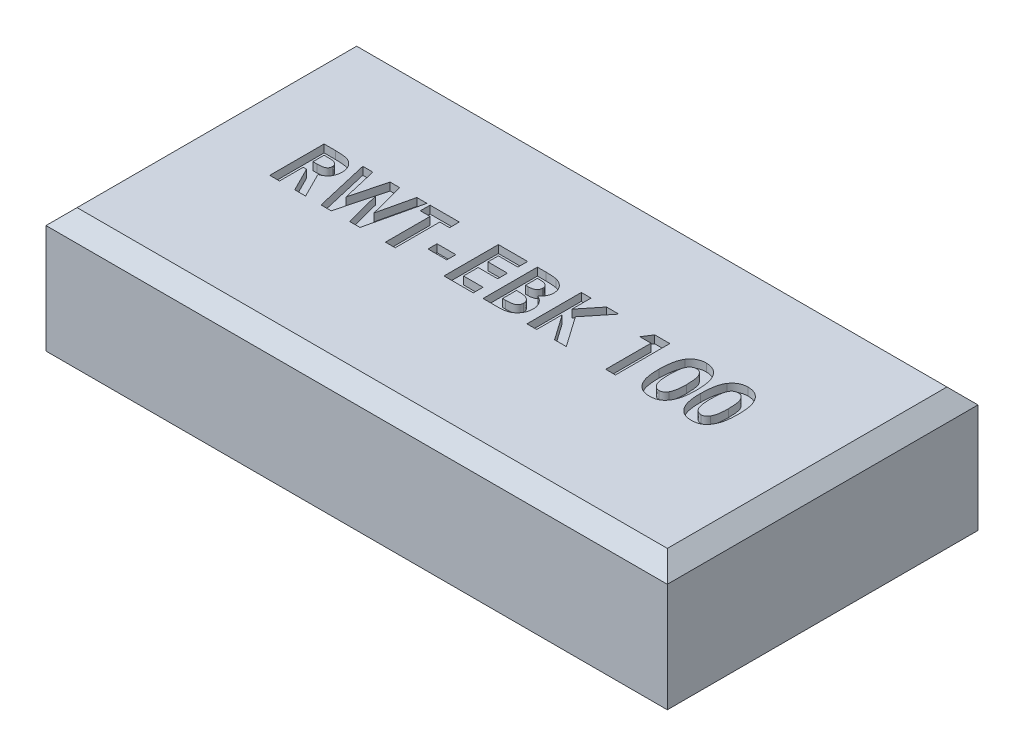
from build123d import *

# Parameters (mm, degrees)
SKETCH1_W           = 40
SKETCH1_H           = 20
BOSS_EXTRUDE1_DEPTH = 8
CHAMFER1_SIZE       = 1
SKETCH3_W           = 1.211538461
SKETCH3_H           = 0.583333333
CUT_EXTRUDE2_DEPTH  = 0.5


with BuildPart() as part:
    # Sketch1 → Boss-Extrude1 (new body)
    with BuildSketch(Plane(origin=(0, 0, 0), x_dir=(1, 0, 0), z_dir=(0, 1, 0))):
        with Locations((0, 2.318501171)):
            Rectangle(SKETCH1_W, SKETCH1_H)
    extrude(amount=BOSS_EXTRUDE1_DEPTH)

    # Chamfer1
    chamfer1_edges = [part.edges().sort_by_distance(p)[0] for p in [
        (0, 8, 7.681498829),
        (-20, 8, -2.318501171),
        (0, 8, -12.318501171),
        (20, 8, -2.318501171),
    ]]
    chamfer(chamfer1_edges, length=CHAMFER1_SIZE)

    # Sketch3 → Cut-Extrude2 (cut)
    # profile 1 of 10: a face of its own
    with BuildSketch(Plane(origin=(0, 8, 0), x_dir=(1, 0, 0), z_dir=(0, 1, 0))):
        with BuildLine():
            Line((-14.596153846, 4.818501171), (-13.864182692, 4.818501171))
            add(Edge.make_bspline(
                [(-13.864182692, 4.818501171), (-13.815799622, 4.818329439), (-13.722745349, 4.81799915), (-13.588566169, 4.81278806), (-13.46530414, 4.805536401), (-13.352776761, 4.794470177), (-13.251032173, 4.779797701), (-13.159968404, 4.76250128), (-13.079588115, 4.742788301), (-13.009213411, 4.718224373), (-12.945703721, 4.690516634), (-12.886503859, 4.658679935), (-12.830307791, 4.623068786), (-12.777491125, 4.582746162), (-12.727594872, 4.538437457), (-12.6805249, 4.49009807), (-12.636946351, 4.437318103), (-12.597129066, 4.380431058), (-12.560838815, 4.320587191), (-12.528765845, 4.257704336), (-12.502684052, 4.191738763), (-12.479637993, 4.123643816), (-12.463038663, 4.052446065), (-12.451494071, 3.978838632), (-12.443041573, 3.902562411), (-12.442555595, 3.850743733), (-12.442307692, 3.824310466)],
                knots=[0, 0, 0, 0, 1.749336639, 3.364467119, 4.854658419, 6.213483162, 7.451590619, 8.570285859, 9.5643256, 10.440900261, 11.26203566, 12.067320669, 12.869050712, 13.665104639, 14.467235401, 15.27997916, 16.102287765, 16.939272006, 17.78853747, 18.631303466, 19.488103222, 20.351255419, 21.228522269, 22.127379805, 23.044756219, 24, 24, 24, 24], degree=3))
            add(Edge.make_bspline(
                [(-12.442307692, 3.824310466), (-12.442951654, 3.796720207), (-12.444214347, 3.742620739), (-12.451015895, 3.663153032), (-12.46344699, 3.587123888), (-12.48227569, 3.514755912), (-12.503916836, 3.4451484), (-12.532694008, 3.379585653), (-12.565171892, 3.317114157), (-12.603744925, 3.258617595), (-12.646076944, 3.20279664), (-12.695308193, 3.151790002), (-12.748249241, 3.102856265), (-12.807876098, 3.059060474), (-12.871560358, 3.017441316), (-12.940567358, 2.979723274), (-13.014446736, 2.944958206), (-13.066387598, 2.925570802), (-13.092948718, 2.91565662)],
                knots=[0, 0, 0, 0, 1.099860209, 2.156625411, 3.176576793, 4.16617041, 5.135385252, 6.078461593, 7.016046972, 7.938469504, 8.868247731, 9.803980173, 10.76021508, 11.73834243, 12.748633912, 13.790971185, 14.870363756, 16, 16, 16, 16], degree=3))
            Line((-13.092948718, 2.91565662), (-12.28525641, 1.318501171))
            Line((-12.28525641, 1.318501171), (-12.983573718, 1.318501171))
            Line((-12.983573718, 1.318501171), (-13.754807692, 2.844142197))
            Line((-13.754807692, 2.844142197), (-13.967948718, 2.844142197))
            Line((-13.967948718, 2.844142197), (-13.967948718, 1.318501171))
            Line((-13.967948718, 1.318501171), (-14.596153846, 1.318501171))
            Line((-14.596153846, 1.318501171), (-14.596153846, 4.818501171))
        make_face()
        with BuildLine():
            Line((-13.967948718, 3.472347325), (-13.723257212, 3.472347325))
            add(Edge.make_bspline(
                [(-13.723257212, 3.472347325), (-13.693341641, 3.472684254), (-13.636059751, 3.473329401), (-13.55368087, 3.476321861), (-13.4788612, 3.483532211), (-13.41127944, 3.492642218), (-13.350595524, 3.503161037), (-13.297350732, 3.518235143), (-13.250724642, 3.534387429), (-13.211269776, 3.554460531), (-13.177560445, 3.577288002), (-13.148454596, 3.603220576), (-13.124379885, 3.633234229), (-13.104565169, 3.666513318), (-13.089151475, 3.70335219), (-13.07790066, 3.743346436), (-13.071613117, 3.786951643), (-13.070889714, 3.817045173), (-13.070512821, 3.832723927)],
                knots=[0, 0, 0, 0, 1.688639943, 3.233382647, 4.650958383, 5.928841754, 7.082724185, 8.122798841, 9.049171256, 9.863274652, 10.613301712, 11.341792392, 12.054588806, 12.776240173, 13.521029143, 14.301969904, 15.115324896, 16, 16, 16, 16], degree=3))
            add(Edge.make_bspline(
                [(-13.070512821, 3.832723927), (-13.071225372, 3.851273039), (-13.072625049, 3.88770933), (-13.086514186, 3.940164814), (-13.108622693, 3.988715953), (-13.1389274, 4.033143381), (-13.177092239, 4.072091531), (-13.220889403, 4.106424636), (-13.27126414, 4.133572687), (-13.317907356, 4.151479252), (-13.36034178, 4.162192934), (-13.398637509, 4.170176676), (-13.442984193, 4.175834983), (-13.493415313, 4.181836624), (-13.549802317, 4.185728385), (-13.612452548, 4.188568594), (-13.681186076, 4.189730664), (-13.729099873, 4.190102157), (-13.754106571, 4.190296043)],
                knots=[0, 0, 0, 0, 1.020303359, 2.004196876, 2.966617323, 3.9489082, 4.950758222, 5.960522915, 7.003732012, 8.091992268, 8.70421221, 9.413913587, 10.24622431, 11.166358409, 12.212345909, 13.359657661, 14.621978493, 16, 16, 16, 16], degree=3))
            Line((-13.754106571, 4.190296043), (-13.967948718, 4.190296043))
            Line((-13.967948718, 4.190296043), (-13.967948718, 3.472347325))
        make_face(mode=Mode.SUBTRACT)
    # profile 2 of 10: a face of its own
    with BuildSketch(Plane(origin=(0, 8, 0), x_dir=(1, 0, 0), z_dir=(0, 1, 0))):
        Polygon((-12.105769231, 4.818501171), (-11.457231571, 4.818501171), (-10.939102564, 2.584026011), (-10.345252404, 4.818501171), (-9.734575321, 4.818501171), (-9.144230769, 2.584026011), (-8.627504006, 4.818501171), (-7.977564103, 4.818501171), (-8.787359776, 1.318501171), (-9.443609776, 1.318501171), (-10.041666667, 3.581021203), (-10.643229167, 1.318501171), (-11.294571314, 1.318501171), align=None)
    # profile 3 of 10: a face of its own
    with BuildSketch(Plane(origin=(0, 8, 0), x_dir=(1, 0, 0), z_dir=(0, 1, 0))):
        Polygon((-7.775641026, 4.818501171), (-5.891025641, 4.818501171), (-5.891025641, 4.190296043), (-6.519230769, 4.190296043), (-6.519230769, 1.318501171), (-7.147435897, 1.318501171), (-7.147435897, 4.190296043), (-7.775641026, 4.190296043), align=None)
    # profile 4 of 10: a face of its own
    with BuildSketch(Plane(origin=(0, 8, 0), x_dir=(1, 0, 0), z_dir=(0, 1, 0))):
        with Locations((-4.791666667, 2.597347325)):
            Rectangle(SKETCH3_W, SKETCH3_H)
    # profile 5 of 10: a face of its own
    with BuildSketch(Plane(origin=(0, 8, 0), x_dir=(1, 0, 0), z_dir=(0, 1, 0))):
        Polygon((-3.378205128, 4.818501171), (-1.493589744, 4.818501171), (-1.493589744, 4.190296043), (-2.75, 4.190296043), (-2.75, 3.51721912), (-1.493589744, 3.51721912), (-1.493589744, 2.889013991), (-2.75, 2.889013991), (-2.75, 1.946706299), (-1.493589744, 1.946706299), (-1.493589744, 1.318501171), (-3.378205128, 1.318501171), align=None)
    # profile 6 of 10: a face of its own
    with BuildSketch(Plane(origin=(0, 8, 0), x_dir=(1, 0, 0), z_dir=(0, 1, 0))):
        with BuildLine():
            Line((-0.865384615, 1.318501171), (-0.865384615, 4.818501171))
            Line((-0.865384615, 4.818501171), (-0.304487179, 4.818501171))
            add(Edge.make_bspline(
                [(-0.304487179, 4.818501171), (-0.265220852, 4.818505652), (-0.189241252, 4.818514323), (-0.079622519, 4.814664873), (0.022039599, 4.809685178), (0.115421572, 4.804114058), (0.200682344, 4.794513904), (0.277692262, 4.784396391), (0.346605192, 4.772195293), (0.389210312, 4.76125053), (0.409254808, 4.756101331)],
                knots=[0, 0, 0, 0, 1.311965854, 2.538629056, 3.664479157, 4.713267157, 5.663616078, 6.530575999, 7.308677837, 8, 8, 8, 8], degree=3))
            add(Edge.make_bspline(
                [(0.409254808, 4.756101331), (0.435575266, 4.748838294), (0.487224455, 4.734585883), (0.561202576, 4.705802524), (0.631381143, 4.673807779), (0.697674471, 4.637307759), (0.759675491, 4.595861807), (0.817148578, 4.549140995), (0.871333285, 4.499020694), (0.920305637, 4.444104065), (0.964568575, 4.386074475), (1.003025131, 4.324947127), (1.03643895, 4.2616567), (1.063178757, 4.195406725), (1.083326699, 4.126502301), (1.09806282, 4.055237661), (1.107613822, 3.981387306), (1.108516267, 3.931144495), (1.108974359, 3.905640594)],
                knots=[0, 0, 0, 0, 1.099996261, 2.158545794, 3.195537121, 4.207578794, 5.205712374, 6.197378256, 7.190519799, 8.17788031, 9.159561366, 10.129234751, 11.085776129, 12.040971148, 13.00380137, 13.975669004, 14.972423361, 16, 16, 16, 16], degree=3))
            add(Edge.make_bspline(
                [(1.108974359, 3.905640594), (1.107776583, 3.872874775), (1.105418909, 3.808379286), (1.090357925, 3.713647082), (1.062116233, 3.624111532), (1.025162666, 3.538122532), (0.974917368, 3.456000819), (0.911115557, 3.377785442), (0.834790614, 3.30106803), (0.776245169, 3.255081117), (0.745793269, 3.231161427)],
                knots=[0, 0, 0, 0, 0.986156485, 1.941127874, 2.875419072, 3.804401753, 4.751181392, 5.761612777, 6.835722519, 8, 8, 8, 8], degree=3))
            add(Edge.make_bspline(
                [(0.745793269, 3.231161427), (0.770470028, 3.218564156), (0.818854324, 3.193864392), (0.887545811, 3.153265354), (0.951146629, 3.110083128), (1.009941945, 3.065186558), (1.062698461, 3.016672412), (1.111594582, 2.967336144), (1.154218027, 2.914350989), (1.192333195, 2.85960544), (1.225462281, 2.802306775), (1.254314061, 2.742551757), (1.278684124, 2.680136252), (1.299321324, 2.615377904), (1.314712554, 2.548053973), (1.324747963, 2.478140383), (1.332431699, 2.405875574), (1.333029422, 2.35665059), (1.333333333, 2.331622165)],
                knots=[0, 0, 0, 0, 1.164658916, 2.283573913, 3.35186032, 4.395461096, 5.390182219, 6.362969632, 7.312859996, 8.245001507, 9.165155236, 10.092416118, 11.032087915, 11.979892451, 12.947605196, 13.931445124, 14.948243989, 16, 16, 16, 16], degree=3))
            add(Edge.make_bspline(
                [(1.333333333, 2.331622165), (1.331361149, 2.283819302), (1.327469051, 2.189480545), (1.29901193, 2.050969584), (1.249676325, 1.91964863), (1.18342878, 1.796039608), (1.101799059, 1.683720797), (1.007948289, 1.585330494), (0.902821331, 1.502045287), (0.805829006, 1.445834233), (0.721938284, 1.40811136), (0.652453165, 1.384788701), (0.577827621, 1.363182624), (0.49669469, 1.348010391), (0.410525202, 1.334123096), (0.318478999, 1.325548791), (0.220728113, 1.319738197), (0.153588579, 1.318921849), (0.118990385, 1.318501171)],
                knots=[0, 0, 0, 0, 1.284142165, 2.534249414, 3.780121997, 5.041676246, 6.291546858, 7.49970053, 8.684500223, 9.883330709, 10.50184324, 11.153274765, 11.851151195, 12.587658647, 13.369265475, 14.195992086, 15.070362669, 16, 16, 16, 16], degree=3))
            Line((0.118990385, 1.318501171), (-0.865384615, 1.318501171))
        make_face()
        with BuildLine():
            Line((-0.237179487, 4.190296043), (-0.237179487, 3.42747553))
            Line((-0.237179487, 3.42747553), (-0.0703125, 3.42747553))
            add(Edge.make_bspline(
                [(-0.0703125, 3.42747553), (-0.047633777, 3.427673297), (-0.003853875, 3.428055074), (0.059381549, 3.432972233), (0.118180282, 3.441361212), (0.172319311, 3.453065948), (0.222302963, 3.467929257), (0.267811927, 3.485813017), (0.308646108, 3.507633149), (0.356085982, 3.540135198), (0.406233349, 3.587963419), (0.450377513, 3.657061193), (0.476378131, 3.736523371), (0.479273899, 3.792566252), (0.480769231, 3.821505979)],
                knots=[0, 0, 0, 0, 1.065314748, 2.056525647, 2.977365736, 3.853934255, 4.656397591, 5.425096493, 6.14721249, 6.826394842, 8.123232004, 9.372140726, 10.643011755, 12, 12, 12, 12], degree=3))
            add(Edge.make_bspline(
                [(0.480769231, 3.821505979), (0.479572691, 3.848612841), (0.47725923, 3.901022871), (0.451079951, 3.97461122), (0.410418355, 4.039825558), (0.362411626, 4.084459439), (0.317203962, 4.114943064), (0.278494386, 4.135015233), (0.236007719, 4.152983634), (0.188921466, 4.166722711), (0.137504514, 4.17703203), (0.082006625, 4.184602991), (0.022332045, 4.189756109), (-0.018885315, 4.190112204), (-0.040164263, 4.190296043)],
                knots=[0, 0, 0, 0, 1.347982417, 2.606269829, 3.849316587, 5.153353503, 5.842674298, 6.568177932, 7.326619318, 8.142485038, 9.012069166, 9.942760135, 10.937925643, 12, 12, 12, 12], degree=3))
            Line((-0.040164263, 4.190296043), (-0.237179487, 4.190296043))
        make_face(mode=Mode.SUBTRACT)
        with BuildLine():
            Line((-0.237179487, 2.844142197), (-0.237179487, 1.946706299))
            Line((-0.237179487, 1.946706299), (-0.056290064, 1.946706299))
            add(Edge.make_bspline(
                [(-0.056290064, 1.946706299), (-0.020527995, 1.946910607), (0.048229046, 1.947303413), (0.146723385, 1.952049449), (0.236279363, 1.960603342), (0.316659689, 1.971282188), (0.387987483, 1.985750355), (0.450021639, 2.004144774), (0.503612874, 2.02438184), (0.548439854, 2.049377018), (0.585060929, 2.078465208), (0.618107609, 2.108194036), (0.645051813, 2.142489048), (0.666370569, 2.179878054), (0.684821916, 2.219432285), (0.695950465, 2.262696318), (0.704423352, 2.308387911), (0.704889637, 2.339991798), (0.705128205, 2.356161427)],
                knots=[0, 0, 0, 0, 1.753078804, 3.370512758, 4.83203934, 6.162291463, 7.344201807, 8.395507345, 9.331626367, 10.147333109, 10.898971645, 11.62040215, 12.321813352, 13.025280112, 13.727906689, 14.453419512, 15.208716525, 16, 16, 16, 16], degree=3))
            add(Edge.make_bspline(
                [(0.705128205, 2.356161427), (0.704602095, 2.374651653), (0.703577374, 2.410665639), (0.695208464, 2.463303922), (0.67999942, 2.512445252), (0.660842888, 2.559346239), (0.634185556, 2.602327663), (0.602504228, 2.642876951), (0.564225095, 2.679620976), (0.521177978, 2.714782156), (0.470967777, 2.745567673), (0.413570936, 2.772279563), (0.348675643, 2.79458835), (0.27608088, 2.81235062), (0.196104895, 2.827425213), (0.108163951, 2.83642641), (0.012990452, 2.843120995), (-0.053004401, 2.843794061), (-0.087139423, 2.844142197)],
                knots=[0, 0, 0, 0, 0.845221588, 1.646264278, 2.427170338, 3.19324141, 3.95557735, 4.731569926, 5.540061037, 6.376114724, 7.268642756, 8.224665384, 9.265483498, 10.400594375, 11.639216012, 12.983232105, 14.439614077, 16, 16, 16, 16], degree=3))
            Line((-0.087139423, 2.844142197), (-0.237179487, 2.844142197))
        make_face(mode=Mode.SUBTRACT)
    # profile 7 of 10: a face of its own
    with BuildSketch(Plane(origin=(0, 8, 0), x_dir=(1, 0, 0), z_dir=(0, 1, 0))):
        Polygon((1.961538462, 4.818501171), (2.58974359, 4.818501171), (2.58974359, 3.586630177), (3.582532051, 4.818501171), (4.375500801, 4.818501171), (3.128205128, 3.270424248), (4.496794872, 1.318501171), (3.740284455, 1.318501171), (2.58974359, 2.959827293), (2.58974359, 1.318501171), (1.961538462, 1.318501171), align=None)
    # profile 8 of 10: a face of its own
    with BuildSketch(Plane(origin=(0, 8, 0), x_dir=(1, 0, 0), z_dir=(0, 1, 0))):
        Polygon((6.689202724, 4.818501171), (7.66025641, 4.818501171), (7.66025641, 1.318501171), (7.032051282, 1.318501171), (7.032051282, 4.235167838), (6.314102564, 4.235167838), align=None)
    # profile 9 of 10: a face of its own
    with BuildSketch(Plane(origin=(0, 8, 0), x_dir=(1, 0, 0), z_dir=(0, 1, 0))):
        with BuildLine():
            add(Edge.make_bspline(
                [(9.915765224, 4.908244761), (9.94617296, 4.907793349), (10.005962692, 4.906905754), (10.094021714, 4.897292372), (10.178846898, 4.882769234), (10.260770092, 4.86251452), (10.339201605, 4.835708128), (10.414712276, 4.803621336), (10.48640331, 4.764571127), (10.555188998, 4.720461909), (10.621042843, 4.670524021), (10.682382094, 4.613592251), (10.740326935, 4.550976601), (10.793623075, 4.481730434), (10.843450772, 4.406483618), (10.889646302, 4.325224221), (10.931856026, 4.237554532), (10.970553014, 4.143316345), (11.005155982, 4.04109707), (11.03430202, 3.929724208), (11.059299625, 3.809172324), (11.080399367, 3.679141347), (11.096347361, 3.539458435), (11.107096631, 3.390216385), (11.114473288, 3.231702915), (11.115075319, 3.122963977), (11.115384615, 3.067098927)],
                knots=[0, 0, 0, 0, 0.879237366, 1.728815576, 2.559023295, 3.367336655, 4.166867292, 4.954216142, 5.737608147, 6.525189134, 7.316157332, 8.124696809, 8.942788509, 9.781158001, 10.649253743, 11.551476218, 12.482711956, 13.461909668, 14.496590415, 15.601789533, 16.789733467, 18.056700938, 19.410929216, 20.8549011, 22.384193279, 24, 24, 24, 24], degree=3))
            add(Edge.make_bspline(
                [(11.115384615, 3.067098927), (11.11505035, 3.010534943), (11.114400879, 2.900632136), (11.10740328, 2.740668821), (11.095353086, 2.590343185), (11.079821925, 2.449670779), (11.058548484, 2.31872589), (11.033634327, 2.19716946), (11.004028228, 2.085045549), (10.968285448, 1.982606796), (10.929822694, 1.888203106), (10.887497509, 1.800704352), (10.842047614, 1.71987354), (10.794515494, 1.644491226), (10.742295263, 1.576779642), (10.687928626, 1.514436242), (10.629048363, 1.459835764), (10.568133562, 1.410164346), (10.502952665, 1.367238273), (10.434177868, 1.329695837), (10.360583034, 1.299244462), (10.283509672, 1.272759483), (10.201644051, 1.253746125), (10.116287005, 1.238659651), (10.026474869, 1.23032194), (9.96532715, 1.229287592), (9.933994391, 1.228757581)],
                knots=[0, 0, 0, 0, 1.643780988, 3.193836972, 4.651895693, 6.025988579, 7.305620092, 8.505800249, 9.631074763, 10.672816429, 11.65661981, 12.592235626, 13.49536222, 14.350718032, 15.179365177, 15.97804903, 16.751647189, 17.51006938, 18.259804725, 19.016521909, 19.783502495, 20.571750527, 21.382245291, 22.22305063, 23.089471752, 24, 24, 24, 24], degree=3))
            add(Edge.make_bspline(
                [(9.933994391, 1.228757581), (9.902662478, 1.229297816), (9.841283721, 1.230356128), (9.751228725, 1.238597657), (9.665419329, 1.253807241), (9.58290602, 1.272905453), (9.504263076, 1.299185861), (9.429113408, 1.330548319), (9.358034851, 1.367856509), (9.2908306, 1.410882596), (9.227730109, 1.460221675), (9.167752798, 1.515346009), (9.111031339, 1.576115872), (9.058428606, 1.643211936), (9.00908312, 1.71573861), (8.963509474, 1.794524112), (8.921735059, 1.879453732), (8.882453162, 1.970645855), (8.848322166, 2.070063741), (8.817947164, 2.17859518), (8.793064761, 2.297144871), (8.773052668, 2.425674728), (8.757075024, 2.563912456), (8.745189494, 2.711924777), (8.738153027, 2.869780633), (8.737510367, 2.978282826), (8.737179487, 3.034146203)],
                knots=[0, 0, 0, 0, 0.917216111, 1.796812873, 2.643793957, 3.46689424, 4.273913431, 5.068098542, 5.848489301, 6.620921603, 7.401012384, 8.190319798, 9.003608147, 9.831726257, 10.68377682, 11.569763213, 12.493818149, 13.453288342, 14.474581811, 15.568529029, 16.750744269, 18.018426408, 19.375425659, 20.823733699, 22.36466933, 24, 24, 24, 24], degree=3))
            add(Edge.make_bspline(
                [(8.737179487, 3.034146203), (8.737778845, 3.111763968), (8.738935314, 3.261528446), (8.753590934, 3.477894573), (8.775101668, 3.677887577), (8.80669584, 3.861172919), (8.845761597, 4.028429436), (8.895787333, 4.178555327), (8.952737994, 4.313627923), (9.001267274, 4.393645742), (9.024639423, 4.432183062)],
                knots=[0, 0, 0, 0, 1.288568992, 2.486310467, 3.599230591, 4.627010532, 5.572937695, 6.447898582, 7.252493626, 8, 8, 8, 8], degree=3))
            add(Edge.make_bspline(
                [(9.024639423, 4.432183062), (9.051815445, 4.470042113), (9.104949923, 4.544064019), (9.197857043, 4.641240945), (9.297673647, 4.72435141), (9.406449911, 4.791514551), (9.522465493, 4.844479409), (9.646716447, 4.881887892), (9.778743933, 4.903683818), (9.869409411, 4.906701743), (9.915765224, 4.908244761)],
                knots=[0, 0, 0, 0, 1.058512271, 2.069600068, 3.047294572, 4.004278952, 4.967380941, 5.939006123, 6.946246673, 8, 8, 8, 8], degree=3))
        make_face()
        with BuildLine():
            add(Edge.make_bspline(
                [(9.931189904, 4.280039632), (9.903701059, 4.278736716), (9.84980833, 4.276182308), (9.771607414, 4.254498986), (9.697868832, 4.221007927), (9.641777862, 4.180706674), (9.599794329, 4.142073089), (9.570460134, 4.107110952), (9.542171926, 4.068095726), (9.517186356, 4.023266856), (9.493593455, 3.974235095), (9.47053608, 3.920777869), (9.451635087, 3.861582152), (9.433065363, 3.797656056), (9.416796552, 3.727232193), (9.403166854, 3.649734927), (9.390989918, 3.564660285), (9.382496359, 3.471952543), (9.374577814, 3.371708697), (9.368901426, 3.263705442), (9.36652827, 3.147971914), (9.365773916, 3.068267952), (9.365384615, 3.027134985)],
                knots=[0, 0, 0, 0, 1.076674018, 2.110852608, 3.161083442, 4.239746716, 4.804137807, 5.395870207, 6.026861976, 6.692161227, 7.405688833, 8.16177676, 8.973626916, 9.841385931, 10.773283133, 11.807421078, 12.927755683, 14.143907515, 15.458935494, 16.872852025, 18.386167141, 20, 20, 20, 20], degree=3))
            add(Edge.make_bspline(
                [(9.365384615, 3.027134985), (9.366025357, 2.973845238), (9.367254027, 2.871658197), (9.373689226, 2.724709674), (9.386588049, 2.590974686), (9.40263158, 2.46954686), (9.425165374, 2.361213689), (9.451091964, 2.264950241), (9.483108996, 2.181983641), (9.520110846, 2.111114005), (9.561092062, 2.050825352), (9.605578975, 1.999579726), (9.652056964, 1.955203432), (9.70197676, 1.919157115), (9.755219267, 1.891532879), (9.81134001, 1.871663107), (9.870374652, 1.859499993), (9.910800967, 1.85781336), (9.931189904, 1.856962709)],
                knots=[0, 0, 0, 0, 1.771748488, 3.397459088, 4.888034009, 6.237357457, 7.467047327, 8.564189669, 9.548206622, 10.417051504, 11.216568818, 11.965764335, 12.669334354, 13.348544111, 14.005342236, 14.656555988, 15.322436492, 16, 16, 16, 16], degree=3))
            add(Edge.make_bspline(
                [(9.931189904, 1.856962709), (9.950879157, 1.857544788), (9.989428267, 1.858684424), (10.045641503, 1.87038264), (10.098800732, 1.889401398), (10.148745452, 1.916304766), (10.195654308, 1.950516515), (10.239298036, 1.992186986), (10.279347487, 2.041731537), (10.302680478, 2.07850092), (10.314703526, 2.097447485)],
                knots=[0, 0, 0, 0, 0.992283464, 1.942767638, 2.88273346, 3.832339453, 4.79467288, 5.803907806, 6.868395428, 8, 8, 8, 8], degree=3))
            add(Edge.make_bspline(
                [(10.314703526, 2.097447485), (10.328858639, 2.12333736), (10.358540763, 2.177626329), (10.392888969, 2.269236938), (10.421801373, 2.372558565), (10.446685858, 2.487912756), (10.463705327, 2.615754481), (10.478362473, 2.755273086), (10.485431979, 2.907171129), (10.486581872, 3.012406641), (10.487179487, 3.067098927)],
                knots=[0, 0, 0, 0, 0.710965849, 1.490837728, 2.352621235, 3.297892224, 4.334225155, 5.461620853, 6.680770821, 8, 8, 8, 8], degree=3))
            add(Edge.make_bspline(
                [(10.487179487, 3.067098927), (10.486948641, 3.122265969), (10.486504303, 3.228453106), (10.478351976, 3.380897234), (10.466999238, 3.520129644), (10.450393459, 3.645839487), (10.429027107, 3.758331932), (10.402692997, 3.857599625), (10.37164704, 3.943838204), (10.334830235, 4.016961676), (10.294053336, 4.079106596), (10.250767413, 4.132422118), (10.204789436, 4.177941565), (10.156196294, 4.215836235), (10.103863282, 4.244790606), (10.04879003, 4.265234787), (9.990863632, 4.27760283), (9.951349628, 4.279216402), (9.931189904, 4.280039632)],
                knots=[0, 0, 0, 0, 1.793836731, 3.452829483, 4.963243077, 6.335886805, 7.574563692, 8.684454726, 9.672768357, 10.54971625, 11.340229787, 12.085688095, 12.778991901, 13.440269426, 14.083255152, 14.715733572, 15.344777694, 16, 16, 16, 16], degree=3))
        make_face(mode=Mode.SUBTRACT)
    # profile 10 of 10: a face of its own
    with BuildSketch(Plane(origin=(0, 8, 0), x_dir=(1, 0, 0), z_dir=(0, 1, 0))):
        with BuildLine():
            add(Edge.make_bspline(
                [(12.608072917, 4.908244761), (12.638480652, 4.907793349), (12.698270385, 4.906905754), (12.786329406, 4.897292372), (12.871154591, 4.882769234), (12.953077785, 4.86251452), (13.031509297, 4.835708128), (13.107019968, 4.803621336), (13.178711003, 4.764571127), (13.247496691, 4.720461909), (13.313350535, 4.670524021), (13.374689786, 4.613592251), (13.432634627, 4.550976601), (13.485930767, 4.481730434), (13.535758465, 4.406483618), (13.581953994, 4.325224221), (13.624163718, 4.237554532), (13.662860706, 4.143316345), (13.697463675, 4.04109707), (13.726609713, 3.929724208), (13.751607317, 3.809172324), (13.772707059, 3.679141347), (13.788655053, 3.539458435), (13.799404323, 3.390216385), (13.80678098, 3.231702915), (13.807383012, 3.122963977), (13.807692308, 3.067098927)],
                knots=[0, 0, 0, 0, 0.879237366, 1.728815576, 2.559023295, 3.367336655, 4.166867292, 4.954216142, 5.737608147, 6.525189134, 7.316157332, 8.124696809, 8.942788509, 9.781158001, 10.649253743, 11.551476218, 12.482711956, 13.461909668, 14.496590415, 15.601789533, 16.789733467, 18.056700938, 19.410929216, 20.8549011, 22.384193279, 24, 24, 24, 24], degree=3))
            add(Edge.make_bspline(
                [(13.807692308, 3.067098927), (13.807358042, 3.010534943), (13.806708571, 2.900632136), (13.799710973, 2.740668821), (13.787660778, 2.590343185), (13.772129618, 2.449670779), (13.750856176, 2.31872589), (13.725942019, 2.19716946), (13.69633592, 2.085045549), (13.660593141, 1.982606796), (13.622130387, 1.888203106), (13.579805201, 1.800704352), (13.534355307, 1.71987354), (13.486823186, 1.644491226), (13.434602955, 1.576779642), (13.380236318, 1.514436242), (13.321356056, 1.459835764), (13.260441254, 1.410164346), (13.195260358, 1.367238273), (13.12648556, 1.329695837), (13.052890726, 1.299244462), (12.975817364, 1.272759483), (12.893951743, 1.253746125), (12.808594697, 1.238659651), (12.718782561, 1.23032194), (12.657634842, 1.229287592), (12.626302083, 1.228757581)],
                knots=[0, 0, 0, 0, 1.643780988, 3.193836972, 4.651895693, 6.025988579, 7.305620092, 8.505800249, 9.631074763, 10.672816429, 11.65661981, 12.592235626, 13.49536222, 14.350718032, 15.179365177, 15.97804903, 16.751647189, 17.51006938, 18.259804725, 19.016521909, 19.783502495, 20.571750527, 21.382245291, 22.22305063, 23.089471752, 24, 24, 24, 24], degree=3))
            add(Edge.make_bspline(
                [(12.626302083, 1.228757581), (12.59497017, 1.229297816), (12.533591414, 1.230356128), (12.443536417, 1.238597657), (12.357727022, 1.253807241), (12.275213712, 1.272905453), (12.196570768, 1.299185861), (12.1214211, 1.330548319), (12.050342543, 1.367856509), (11.983138292, 1.410882596), (11.920037802, 1.460221675), (11.86006049, 1.515346009), (11.803339031, 1.576115872), (11.750736299, 1.643211936), (11.701390812, 1.71573861), (11.655817167, 1.794524112), (11.614042751, 1.879453732), (11.574760854, 1.970645855), (11.540629858, 2.070063741), (11.510254856, 2.17859518), (11.485372454, 2.297144871), (11.46536036, 2.425674728), (11.449382717, 2.563912456), (11.437497186, 2.711924777), (11.43046072, 2.869780633), (11.429818059, 2.978282826), (11.429487179, 3.034146203)],
                knots=[0, 0, 0, 0, 0.917216111, 1.796812873, 2.643793957, 3.46689424, 4.273913431, 5.068098542, 5.848489301, 6.620921603, 7.401012384, 8.190319798, 9.003608147, 9.831726257, 10.68377682, 11.569763213, 12.493818149, 13.453288342, 14.474581811, 15.568529029, 16.750744269, 18.018426408, 19.375425659, 20.823733699, 22.36466933, 24, 24, 24, 24], degree=3))
            add(Edge.make_bspline(
                [(11.429487179, 3.034146203), (11.430086537, 3.111763968), (11.431243006, 3.261528446), (11.445898626, 3.477894573), (11.46740936, 3.677887577), (11.499003532, 3.861172919), (11.538069289, 4.028429436), (11.588095025, 4.178555327), (11.645045686, 4.313627923), (11.693574966, 4.393645742), (11.716947115, 4.432183062)],
                knots=[0, 0, 0, 0, 1.288568992, 2.486310467, 3.599230591, 4.627010532, 5.572937695, 6.447898582, 7.252493626, 8, 8, 8, 8], degree=3))
            add(Edge.make_bspline(
                [(11.716947115, 4.432183062), (11.744123137, 4.470042113), (11.797257615, 4.544064019), (11.890164735, 4.641240945), (11.989981339, 4.72435141), (12.098757603, 4.791514551), (12.214773185, 4.844479409), (12.339024139, 4.881887892), (12.471051626, 4.903683818), (12.561717103, 4.906701743), (12.608072917, 4.908244761)],
                knots=[0, 0, 0, 0, 1.058512271, 2.069600068, 3.047294572, 4.004278952, 4.967380941, 5.939006123, 6.946246673, 8, 8, 8, 8], degree=3))
        make_face()
        with BuildLine():
            add(Edge.make_bspline(
                [(12.623497596, 4.280039632), (12.596008751, 4.278736716), (12.542116023, 4.276182308), (12.463915106, 4.254498986), (12.390176524, 4.221007927), (12.334085555, 4.180706674), (12.292102022, 4.142073089), (12.262767826, 4.107110952), (12.234479618, 4.068095726), (12.209494048, 4.023266856), (12.185901148, 3.974235095), (12.162843773, 3.920777869), (12.14394278, 3.861582152), (12.125373055, 3.797656056), (12.109104244, 3.727232193), (12.095474546, 3.649734927), (12.08329761, 3.564660285), (12.074804052, 3.471952543), (12.066885506, 3.371708697), (12.061209118, 3.263705442), (12.058835962, 3.147971914), (12.058081608, 3.068267952), (12.057692308, 3.027134985)],
                knots=[0, 0, 0, 0, 1.076674018, 2.110852608, 3.161083442, 4.239746716, 4.804137807, 5.395870207, 6.026861976, 6.692161227, 7.405688833, 8.16177676, 8.973626916, 9.841385931, 10.773283133, 11.807421078, 12.927755683, 14.143907515, 15.458935494, 16.872852025, 18.386167141, 20, 20, 20, 20], degree=3))
            add(Edge.make_bspline(
                [(12.057692308, 3.027134985), (12.05833305, 2.973845238), (12.05956172, 2.871658197), (12.065996919, 2.724709674), (12.078895741, 2.590974686), (12.094939272, 2.46954686), (12.117473067, 2.361213689), (12.143399656, 2.264950241), (12.175416688, 2.181983641), (12.212418538, 2.111114005), (12.253399754, 2.050825352), (12.297886667, 1.999579726), (12.344364656, 1.955203432), (12.394284452, 1.919157115), (12.44752696, 1.891532879), (12.503647703, 1.871663107), (12.562682345, 1.859499993), (12.603108659, 1.85781336), (12.623497596, 1.856962709)],
                knots=[0, 0, 0, 0, 1.771748488, 3.397459088, 4.888034009, 6.237357457, 7.467047327, 8.564189669, 9.548206622, 10.417051504, 11.216568818, 11.965764335, 12.669334354, 13.348544111, 14.005342236, 14.656555988, 15.322436492, 16, 16, 16, 16], degree=3))
            add(Edge.make_bspline(
                [(12.623497596, 1.856962709), (12.64318685, 1.857544788), (12.681735959, 1.858684424), (12.737949195, 1.87038264), (12.791108425, 1.889401398), (12.841053145, 1.916304766), (12.887962, 1.950516515), (12.931605729, 1.992186986), (12.971655179, 2.041731537), (12.994988171, 2.07850092), (13.007011218, 2.097447485)],
                knots=[0, 0, 0, 0, 0.992283464, 1.942767638, 2.88273346, 3.832339453, 4.79467288, 5.803907806, 6.868395428, 8, 8, 8, 8], degree=3))
            add(Edge.make_bspline(
                [(13.007011218, 2.097447485), (13.021166331, 2.12333736), (13.050848455, 2.177626329), (13.085196661, 2.269236938), (13.114109066, 2.372558565), (13.13899355, 2.487912756), (13.156013019, 2.615754481), (13.170670165, 2.755273086), (13.177739671, 2.907171129), (13.178889565, 3.012406641), (13.179487179, 3.067098927)],
                knots=[0, 0, 0, 0, 0.710965849, 1.490837728, 2.352621235, 3.297892224, 4.334225155, 5.461620853, 6.680770821, 8, 8, 8, 8], degree=3))
            add(Edge.make_bspline(
                [(13.179487179, 3.067098927), (13.179256334, 3.122265969), (13.178811995, 3.228453106), (13.170659668, 3.380897234), (13.15930693, 3.520129644), (13.142701151, 3.645839487), (13.121334799, 3.758331932), (13.095000689, 3.857599625), (13.063954732, 3.943838204), (13.027137927, 4.016961676), (12.986361029, 4.079106596), (12.943075106, 4.132422118), (12.897097128, 4.177941565), (12.848503986, 4.215836235), (12.796170975, 4.244790606), (12.741097722, 4.265234787), (12.683171324, 4.27760283), (12.64365732, 4.279216402), (12.623497596, 4.280039632)],
                knots=[0, 0, 0, 0, 1.793836731, 3.452829483, 4.963243077, 6.335886805, 7.574563692, 8.684454726, 9.672768357, 10.54971625, 11.340229787, 12.085688095, 12.778991901, 13.440269426, 14.083255152, 14.715733572, 15.344777694, 16, 16, 16, 16], degree=3))
        make_face(mode=Mode.SUBTRACT)
    extrude(amount=-CUT_EXTRUDE2_DEPTH, mode=Mode.SUBTRACT)


solid = part.part
